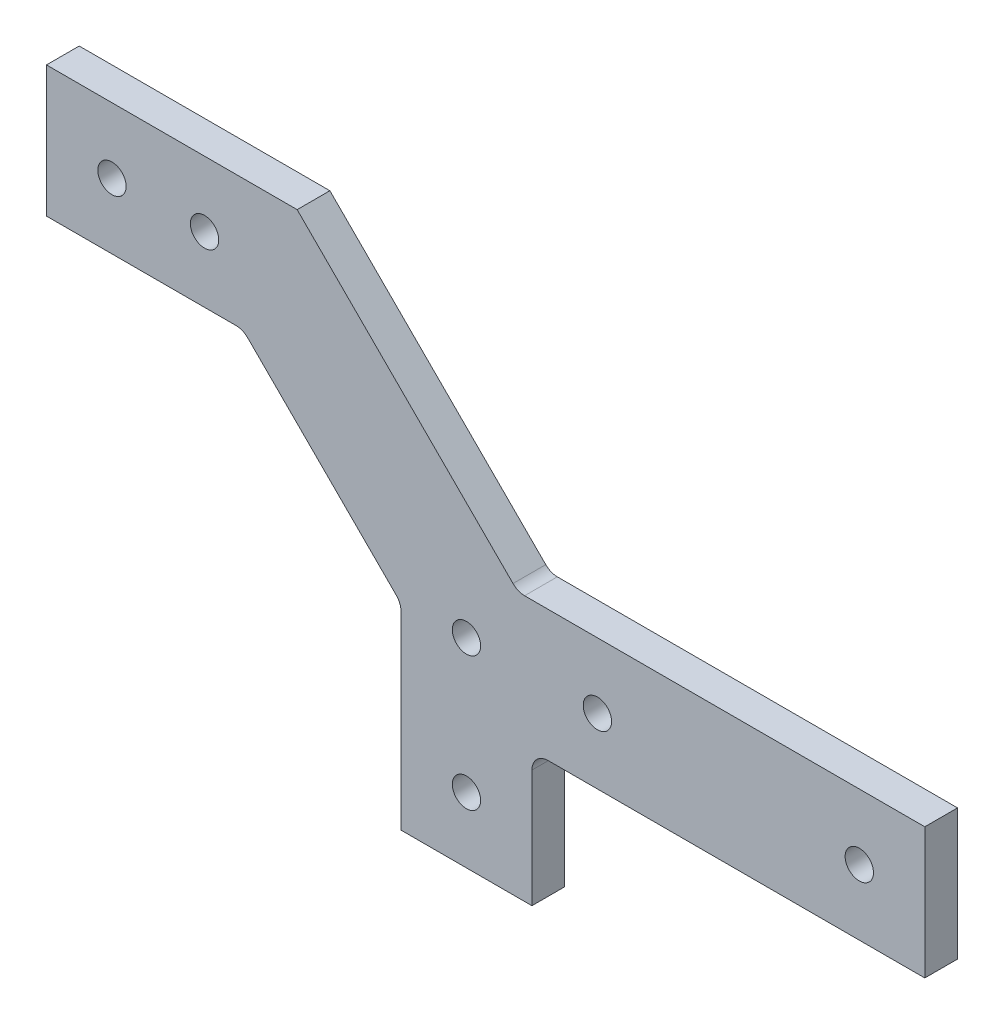
from build123d import *

# Parameters (mm, degrees)
BOSS_EXTRUDE1_DEPTH      = 6.35
FILLET1_R                = 3.175
M5_CLEARANCE_HOLE1_D     = 5.5
M5_CLEARANCE_HOLE1_DEPTH = 18.75
M5_CLEARANCE_HOLE1_TIP   = 1.652366702


with BuildPart() as part:
    # Sketch1 → Boss-Extrude1 (new body)
    with BuildSketch(Plane.XY):
        Polygon((-12.7, 46.1), (-12.7, 58.239487758), (-43.360512242, 88.9), (-81.460512242, 88.9), (-81.460512242, 114.3), (-32.839487758, 114.3), (9.960512242, 71.5), (12.7, 71.5), (88.9, 71.5), (88.9, 46.1), (12.7, 46.1), (12.7, 20.139487758), (-12.7, 20.139487758), align=None)
    extrude(amount=BOSS_EXTRUDE1_DEPTH)

    # Fillet1
    fillet1_edges = [part.edges().sort_by_distance(p)[0] for p in [
        (-43.360512242, 88.9, 3.175),
        (-12.7, 58.239487758, 3.175),
        (12.7, 46.1, 3.175),
        (9.960512242, 71.5, 3.175),
    ]]
    fillet(fillet1_edges, radius=FILLET1_R)

    # M5 Clearance Hole1
    with Locations(Plane.XY.offset(6.35)):
        with Locations((0, 58.8), (25.4, 58.8), (76.2, 58.8), (-50.8, 101.6), (-68.760512242, 101.6), (0, 32.839487758)):
            Hole(M5_CLEARANCE_HOLE1_D / 2, depth=M5_CLEARANCE_HOLE1_DEPTH)
            with Locations((0, 0, -(M5_CLEARANCE_HOLE1_DEPTH + M5_CLEARANCE_HOLE1_TIP / 2))):  # 118° drill point
                Cone(0, M5_CLEARANCE_HOLE1_D / 2, M5_CLEARANCE_HOLE1_TIP, mode=Mode.SUBTRACT)


solid = part.part
